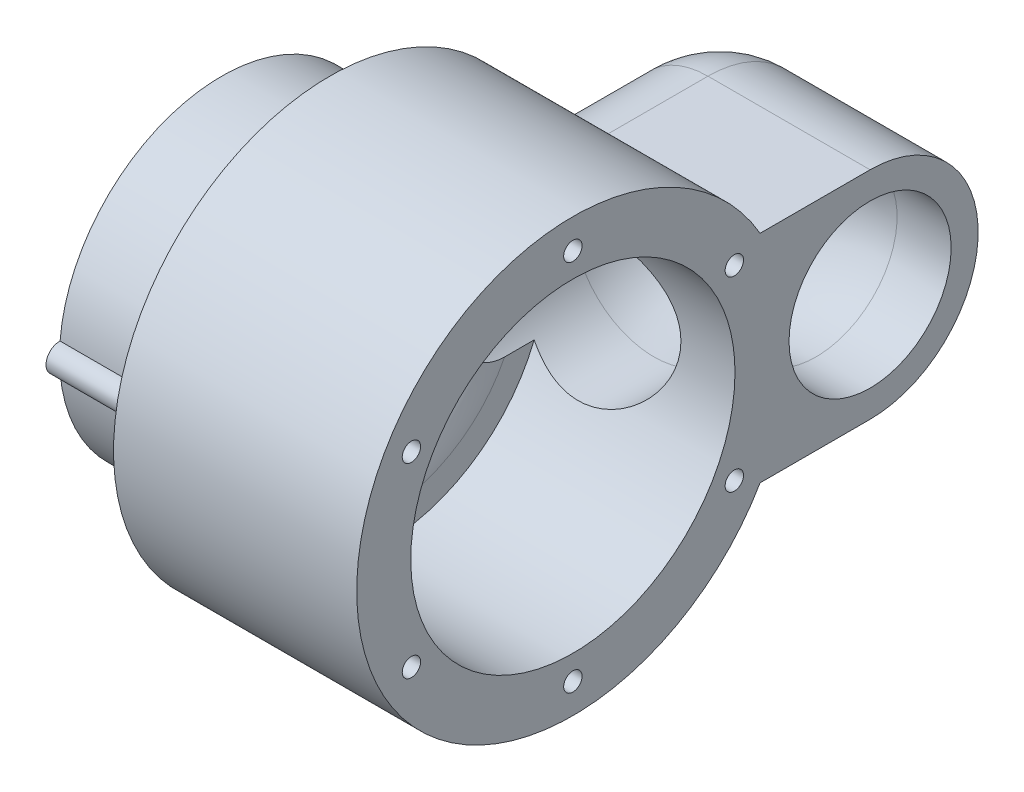
from build123d import *

# Parameters (mm, degrees)
CROQUIS1_R                                           = 15
SALIENTE_EXTRUIR1_DEPTH                              = 10
CROQUIS2_R                                           = 40
CROQUIS2_R_2                                         = 15
SALIENTE_EXTRUIR2_DEPTH                              = 10
CROQUIS3_R                                           = 40
CROQUIS3_R_2                                         = 30
SALIENTE_EXTRUIR3_DEPTH                              = 35
REFRENTADO_PARA_TORNILLO_CON_CABEZA_TRON_D           = 3.4
REFRENTADO_PARA_TORNILLO_CON_CABEZA_TRON_CBORE_D     = 7
REFRENTADO_PARA_TORNILLO_CON_CABEZA_TRON_CBORE_DEPTH = 2.4
SALIENTE_EXTRUIR4_START                              = -45
SALIENTE_EXTRUIR4_DEPTH                              = 45
REDONDEO1_R                                          = 15
CORTAR_BARRER4_PROFILE_R                             = 15


with BuildPart() as part:
    # Croquis1 → Saliente-Extruir1 (new, symmetric)
    with BuildSketch(Plane(origin=(0, 0, 0), x_dir=(0, 0, -1), z_dir=(1, 0, 0))):
        with BuildLine():
            ThreePointArc((-29.895833333, -2.497828918), (30, 0), (-29.895833333, 2.497828918))
            ThreePointArc((-29.895833333, 2.497828918), (-32.5, 0), (-29.895833333, -2.497828918))
        make_face()
        Circle(CROQUIS1_R, mode=Mode.SUBTRACT)
    extrude(amount=SALIENTE_EXTRUIR1_DEPTH, both=True)

    # Croquis2 → Saliente-Extruir2 (add)
    with BuildSketch(Plane(origin=(10, 0, 0), x_dir=(0, 0, -1), z_dir=(1, 0, 0))):
        Circle(CROQUIS2_R)
        Circle(CROQUIS2_R_2, mode=Mode.SUBTRACT)
    extrude(amount=SALIENTE_EXTRUIR2_DEPTH)

    # Croquis3 → Saliente-Extruir3 (add)
    with BuildSketch(Plane(origin=(20, 0, 0), x_dir=(0, 0, -1), z_dir=(1, 0, 0))):
        Circle(CROQUIS3_R)
        Circle(CROQUIS3_R_2, mode=Mode.SUBTRACT)
    extrude(amount=SALIENTE_EXTRUIR3_DEPTH)

    # Refrentado para tornillo con cabeza troncocónica de M31 (through all)
    with Locations(Plane.ZY.offset(-10)):
        with Locations((0, 34.5), (29.877876431, 17.25), (29.877876431, -17.25), (0, -34.5), (-29.877876431, -17.25), (-29.877876431, 17.25)):
            CounterBoreHole(REFRENTADO_PARA_TORNILLO_CON_CABEZA_TRON_D / 2, REFRENTADO_PARA_TORNILLO_CON_CABEZA_TRON_CBORE_D / 2, REFRENTADO_PARA_TORNILLO_CON_CABEZA_TRON_CBORE_DEPTH)

    # Croquis8 → Saliente-Extruir4 (add)
    with BuildSketch(Plane(origin=(55, 0, 0), x_dir=(0, 0, -1), z_dir=(1, 0, 0)).offset(SALIENTE_EXTRUIR4_START)):
        with BuildLine():
            Line((55, 20), (34.641016151, 20))
            ThreePointArc((34.641016151, 20), (40, 0), (34.641016151, -20))
            Line((34.641016151, -20), (55, -20))
            ThreePointArc((55, -20), (75, 0), (55, 20))
        make_face()
    extrude(amount=SALIENTE_EXTRUIR4_DEPTH)

    # Redondeo1
    redondeo1_edges = [part.edges().sort_by_distance(p)[0] for p in [
        (10, 0, -75),
        (10, -20, -44.820508076),
        (10, 20, -44.820508076),
    ]]
    fillet(redondeo1_edges, radius=REDONDEO1_R)

    # Cortar-Barrer4: sweep along a path in Croquis17
    with BuildLine(Plane(origin=(0, 0, 0), x_dir=(1, 0, 0), z_dir=(0, 1, 0))) as cortar_barrer4_path:
        Line((55, 55), (45, 55))
        ThreePointArc((45, 55), (34.393398282, 50.606601718), (30, 40))
        Line((30, 40), (30, 0))
    # Cortar-Barrer4 profile (on start of the path) → Cortar-Barrer4 (sweep, cut)
    with BuildSketch(Plane(origin=(55, 0, -55), x_dir=(0, 0, -1), z_dir=(-1, 0, 0))):
        Circle(CORTAR_BARRER4_PROFILE_R)
    sweep(path=cortar_barrer4_path.line, mode=Mode.SUBTRACT)

    # Redondeo2: read off the stored shape, not the designer's step
    # Redondeo2 outline → Redondeo2 (revolve, cut)
    with BuildSketch(Plane.YX):
        with BuildLine():
            ThreePointArc((15, 10), (17.928933196, 17.071068819), (25.00000285, 20))
            Line((25.00000285, 20), (15, 20))
            Line((15, 20), (15, 10))
        make_face()
    revolve(axis=Axis((0, 0, 0), (1, 0, 0)), mode=Mode.SUBTRACT)


solid = part.part
